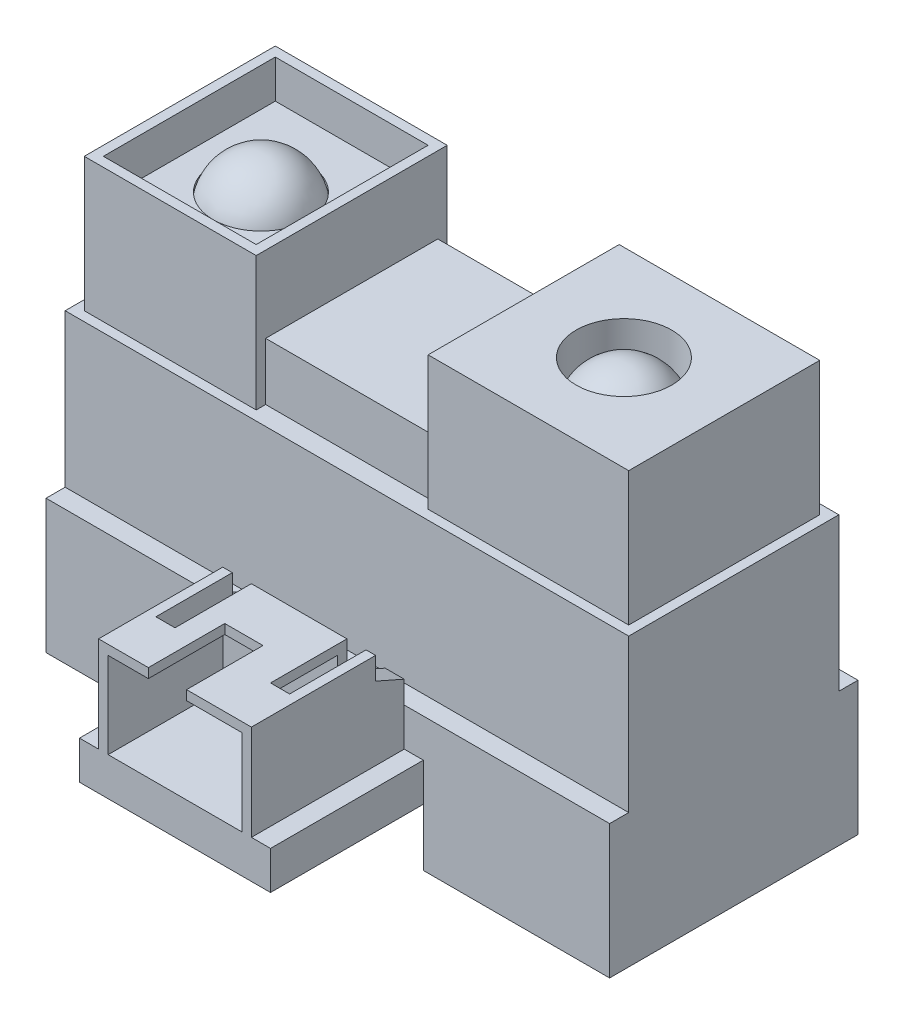
from build123d import *

# Parameters (mm, degrees)
EXTRUDE_1_DEPTH          = 7
CUT_EXTRUDE_START        = -5
SKETCH_2_R               = 4
CUT_EXTRUDE_1_DEPTH      = 5
SKETCH_3_W               = 29.5
SKETCH_3_H               = 11
EXTRUDE_2_DEPTH          = 8
SKETCH_4_W               = 10.5
SKETCH_4_H               = 10
SKETCH_4_W_2             = 9
EXTRUDE_3_DEPTH          = 7
SKETCH_5_W               = 8
SKETCH_5_H               = 9
CUT_EXTRUDE_2_DEPTH      = 2
SKETCH_6_R               = 2.5
CUT_EXTRUDE_3_DEPTH      = 2.2
SKETCH_7_R               = 1.6
CUT_EXTRUDE_4_DEPTH      = 45.443784717
SKETCH_8_W               = 10
SKETCH_8_H               = 5
EXTRUDE_4_DEPTH          = 8
CUT_EXTRUDE_5_DEPTH      = 3
SKETCH_11_W              = 8
SKETCH_11_H              = 6.5
EXTRUDE_6_DEPTH          = 5
EXTRUDE_7_DEPTH          = 1
EXTRUDE_8_DEPTH          = 1
CUT_EXTRUDE_6_DEPTH      = 4
SKETCH_15_W              = 7
SKETCH_15_H              = 4.5
CUT_EXTRUDE_7_DEPTH      = 2
SKETCH_16_W              = 1
SKETCH_16_H              = 4
CUT_EXTRUDE_8_DEPTH      = 1
CUT_EXTRUDE_9_DEPTH      = 46.521972716
CUT_EXTRUDE_9_DEPTH_BACK = 46.521972716
SKETCH_17_W              = 8.500817713
SKETCH_17_H              = 8.67771192
SKETCH_17_W_2            = 8.381247082
SKETCH_17_H_2            = 10.001242217
SKETCH_18_W              = 9
SKETCH_18_H              = 9.010392854
EXTRUDE_9_DEPTH          = 3


# Read off the part's stored shape, not the designer's step: 圆顶1, 圆顶2
with BuildPart() as part:
    # 草图1 → 凸台-拉伸1 (new body)
    with BuildSketch(Plane(origin=(0, 0, 0), x_dir=(1, 0, 0), z_dir=(0, 1, 0))):
        with BuildLine():
            Line((0, 0), (29.5, 0))
            Line((29.5, 0), (29.5, -2.5))
            Line((29.5, -2.5), (33.5, -2.5))
            ThreePointArc((33.5, -2.5), (37.5, -6.5), (33.5, -10.5))
            Line((33.5, -10.5), (29.5, -10.5))
            Line((29.5, -10.5), (29.5, -13))
            Line((29.5, -13), (0, -13))
            Line((0, -13), (0, -10.5))
            Line((0, -10.5), (-4, -10.5))
            ThreePointArc((-4, -10.5), (-8, -6.5), (-4, -2.5))
            Line((-4, -2.5), (0, -2.5))
            Line((0, -2.5), (0, 0))
        make_face()
    extrude(amount=EXTRUDE_1_DEPTH)

    # 草图2 → 切除-拉伸1 (cut)
    with BuildSketch(Plane(origin=(0, 7, 0), x_dir=(1, 0, 0), z_dir=(0, 1, 0)).offset(CUT_EXTRUDE_START)):
        with Locations((-4, -6.5)):
            Circle(SKETCH_2_R)
        with Locations((33.5, -6.5)):
            Circle(SKETCH_2_R)
    extrude(amount=CUT_EXTRUDE_1_DEPTH, mode=Mode.SUBTRACT)

    # 草图3 → 凸台-拉伸2 (add)
    with BuildSketch(Plane(origin=(0, 7, 0), x_dir=(1, 0, 0), z_dir=(0, 1, 0))):
        with Locations((14.75, -6.5)):
            Rectangle(SKETCH_3_W, SKETCH_3_H)
    extrude(amount=EXTRUDE_2_DEPTH)

    # 草图4 → 凸台-拉伸3 (add)
    with BuildSketch(Plane(origin=(0, 15, 0), x_dir=(1, 0, 0), z_dir=(0, 1, 0))):
        with Locations((23.75, -6.5)):
            Rectangle(SKETCH_4_W, SKETCH_4_H)
        with Locations((5, -6.5)):
            Rectangle(SKETCH_4_W_2, SKETCH_4_H)
    extrude(amount=EXTRUDE_3_DEPTH)

    # 草图5 → 切除-拉伸2 (cut)
    with BuildSketch(Plane(origin=(0, 22, 0), x_dir=(1, 0, 0), z_dir=(0, 1, 0))):
        with Locations((5, -6.5)):
            Rectangle(SKETCH_5_W, SKETCH_5_H)
    extrude(amount=-CUT_EXTRUDE_2_DEPTH, mode=Mode.SUBTRACT)

    # 草图6 → 切除-拉伸3 (cut)
    with BuildSketch(Plane(origin=(0, 22, 0), x_dir=(1, 0, 0), z_dir=(0, 1, 0))):
        with Locations(Location((23.75, -6.5, 0), (0, 0, 270))):
            Circle(SKETCH_6_R)
        with Locations(Location((4.75, -6.5, 0), (0, 0, 270))):
            Circle(SKETCH_6_R)
    extrude(amount=-CUT_EXTRUDE_3_DEPTH, mode=Mode.SUBTRACT)

    # 圆顶1 outline → 圆顶1 (revolve)
    with BuildSketch(Plane(origin=(4.75, 0, 6.5), x_dir=(1, 0, 0), z_dir=(0, 0, 1))):
        with BuildLine():
            Line((0, 19.8), (2.500000001, 19.799999998))
            ThreePointArc((2.500000001, 19.799999998), (1.60078106, 21.238476323), (0, 21.8))
            Line((0, 21.8), (0, 19.8))
        make_face()
    revolve(axis=Axis((4.75, 0, 6.5), (0, 1, 0)))

    # 圆顶2 outline → 圆顶2 (revolve)
    with BuildSketch(Plane(origin=(23.75, 0, 6.5), x_dir=(1, 0, 0), z_dir=(0, 0, 1))):
        with BuildLine():
            Line((0, 19.8), (2.500000001, 19.799999997))
            ThreePointArc((2.500000001, 19.799999997), (1.60078106, 21.238476323), (0, 21.8))
            Line((0, 21.8), (0, 19.8))
        make_face()
    revolve(axis=Axis((23.75, 0, 6.5), (0, 1, 0)))

    # 草图7 → 切除-拉伸4 (cut, through all)
    with BuildSketch(Plane(origin=(0, 2, 0), x_dir=(1, 0, 0), z_dir=(0, 1, 0))):
        with Locations(Location((-4, -6.5, 0), (0, 0, 270))):
            Circle(SKETCH_7_R)
        with Locations(Location((33.5, -6.5, 0), (0, 0, 270))):
            Circle(SKETCH_7_R)
    extrude(amount=-CUT_EXTRUDE_4_DEPTH, mode=Mode.SUBTRACT)

    # 草图8 → 凸台-拉伸4 (add)
    with BuildSketch(Plane.XY.offset(13)):
        with Locations((14.75, 2.5)):
            Rectangle(SKETCH_8_W, SKETCH_8_H)
    extrude(amount=EXTRUDE_4_DEPTH)

    # 草图10 → 切除-拉伸5 (cut)
    with BuildSketch(Plane.XZ):
        Polygon((9.75, 21), (9.75, 12), (1, 12), (1, 1), (28.5, 1), (28.5, 12), (19.75, 12), (19.75, 21), align=None)
    extrude(amount=-CUT_EXTRUDE_5_DEPTH, mode=Mode.SUBTRACT)

    # 草图11 → 凸台-拉伸6 (add)
    with BuildSketch(Plane(origin=(0, 5, 0), x_dir=(1, 0, 0), z_dir=(0, 1, 0))):
        with Locations((14.75, -17.75)):
            Rectangle(SKETCH_11_W, SKETCH_11_H)
    extrude(amount=EXTRUDE_6_DEPTH)

    # 草图12 → 凸台-拉伸7 (add)
    with BuildSketch(Plane(origin=(18.75, 0, 0), x_dir=(0, 0, -1), z_dir=(1, 0, 0))):
        Polygon((-14.5, 8.832927064), (-13, 8.172497524), (-13, 5), (-14.5, 5), align=None)
    extrude(amount=-EXTRUDE_7_DEPTH)

    # 草图13 → 凸台-拉伸8 (add)
    with BuildSketch(Plane.ZY.offset(-10.75)):
        Polygon((14.5, 8.832927064), (13, 8.172497524), (13, 5), (14.5, 5), align=None)
    extrude(amount=-EXTRUDE_8_DEPTH)

    # 草图14 → 切除-拉伸6 (cut)
    with BuildSketch(Plane.XY.offset(21)):
        Polygon((11.25, 5), (18.25, 5), (18.25, 9.5), (15.355989936, 9.5), (15.355989936, 10), (13.355989936, 10), (13.355989936, 9.5), (11.25, 9.5), align=None)
    extrude(amount=-CUT_EXTRUDE_6_DEPTH, mode=Mode.SUBTRACT)

    # 草图15 → 切除-拉伸7 (cut)
    with BuildSketch(Plane.XY.offset(17)):
        with Locations((14.75, 7.25)):
            Rectangle(SKETCH_15_W, SKETCH_15_H)
    extrude(amount=-CUT_EXTRUDE_7_DEPTH, mode=Mode.SUBTRACT)

    # 草图16 → 切除-拉伸8 (cut)
    with BuildSketch(Plane(origin=(0, 10, 0), x_dir=(1, 0, 0), z_dir=(0, 1, 0))):
        with Locations((11.75, -16.5)):
            Rectangle(SKETCH_16_W, SKETCH_16_H)
        with Locations((17.75, -16.5)):
            Rectangle(SKETCH_16_W, SKETCH_16_H)
    extrude(amount=-CUT_EXTRUDE_8_DEPTH, mode=Mode.SUBTRACT)

    # 草图17 → 切除-拉伸9 (cut, two sides: drawn at the far end of the back side and taken through both)
    with BuildSketch(Plane(origin=(0, 15, 0), x_dir=(1, 0, 0), z_dir=(0, 1, 0)).offset(-CUT_EXTRUDE_9_DEPTH_BACK)):
        with Locations((33.750408857, -6.83885596)):
            Rectangle(SKETCH_17_W, SKETCH_17_H)
        with Locations((-4.190623541, -7.500621109)):
            Rectangle(SKETCH_17_W_2, SKETCH_17_H_2)
    extrude(amount=CUT_EXTRUDE_9_DEPTH + CUT_EXTRUDE_9_DEPTH_BACK, mode=Mode.SUBTRACT)

    # 草图18 → 凸台-拉伸9 (add)
    with BuildSketch(Plane(origin=(0, 15, 0), x_dir=(1, 0, 0), z_dir=(0, 1, 0))):
        with Locations((14, -6.5)):
            Rectangle(SKETCH_18_W, SKETCH_18_H)
    extrude(amount=EXTRUDE_9_DEPTH)


solid = part.part
